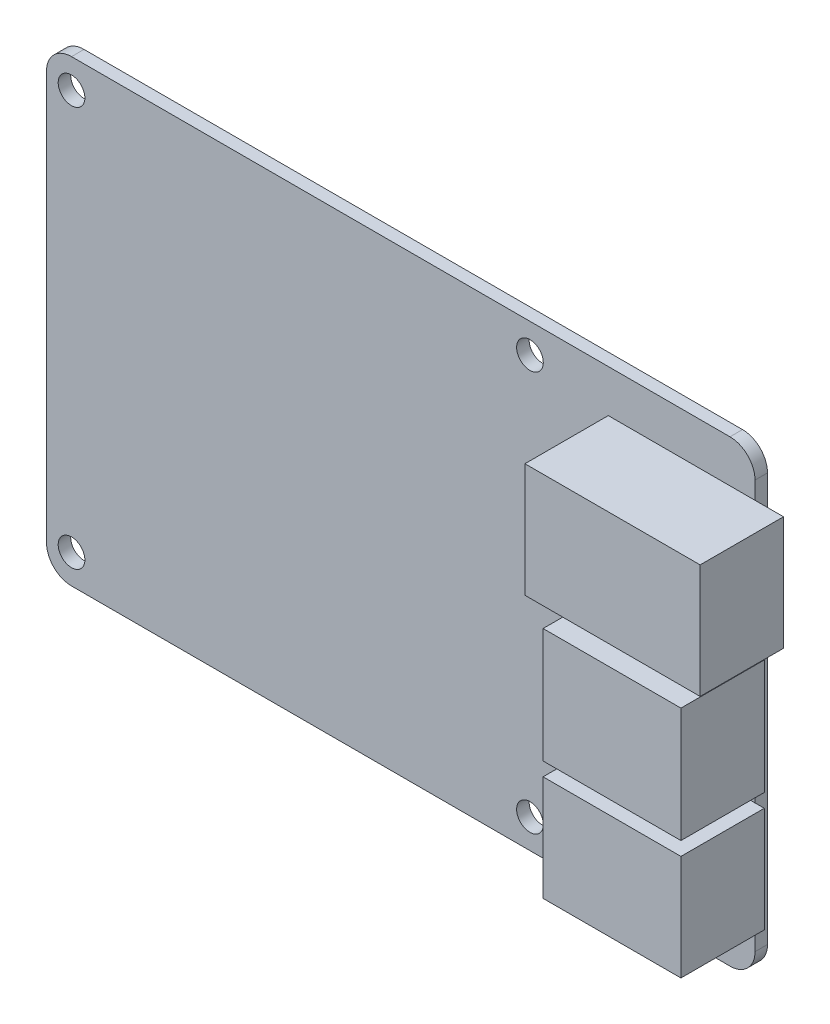
from build123d import *

# Parameters (mm, degrees)
SKETCH1_R           = 1.6
BOSS_EXTRUDE1_DEPTH = 1.5
SKETCH2_W           = 21.020817279
SKETCH2_H           = 13.668708773
SKETCH2_W_2         = 16.538575955
SKETCH2_H_2         = 13.76502595
SKETCH2_H_3         = 12.635061133
BOSS_EXTRUDE2_DEPTH = 10


with BuildPart() as part:
    # Sketch1 → Boss-Extrude1 (new body)
    with BuildSketch(Plane.XY):
        with BuildLine():
            Line((86.342063859, 25.576361327), (7.342063859, 25.576361327))
            ThreePointArc((7.342063859, 25.576361327), (5.220743515, 24.697681671), (4.342063859, 22.576361327))
            Line((4.342063859, 22.576361327), (4.342063859, -26.423638673))
            ThreePointArc((4.342063859, -26.423638673), (5.220743515, -28.544959016), (7.342063859, -29.423638673))
            Line((7.342063859, -29.423638673), (86.342063859, -29.423638673))
            ThreePointArc((86.342063859, -29.423638673), (88.463384202, -28.544959016), (89.342063859, -26.423638673))
            Line((89.342063859, -26.423638673), (89.342063859, 22.576361327))
            ThreePointArc((89.342063859, 22.576361327), (88.463384202, 24.697681671), (86.342063859, 25.576361327))
        make_face()
        with Locations((7.342063859, -25.923638673)):
            Circle(SKETCH1_R, mode=Mode.SUBTRACT)
        with Locations((62.342063859, -25.923638673)):
            Circle(SKETCH1_R, mode=Mode.SUBTRACT)
        with Locations((7.342063859, 22.076361327)):
            Circle(SKETCH1_R, mode=Mode.SUBTRACT)
        with Locations((62.342063859, 22.076361327)):
            Circle(SKETCH1_R, mode=Mode.SUBTRACT)
    extrude(amount=BOSS_EXTRUDE1_DEPTH)

    # Sketch2 → Boss-Extrude2 (add)
    with BuildSketch(Plane.XY.offset(1.5)):
        with Locations((82.249107191, 13.642831506)):
            Rectangle(SKETCH2_W, SKETCH2_H)
        with Locations((82.18632648, -2.437513953)):
            Rectangle(SKETCH2_W_2, SKETCH2_H_2)
        with Locations((82.18632648, -17.281142683)):
            Rectangle(SKETCH2_W_2, SKETCH2_H_3)
    extrude(amount=BOSS_EXTRUDE2_DEPTH)


solid = part.part
